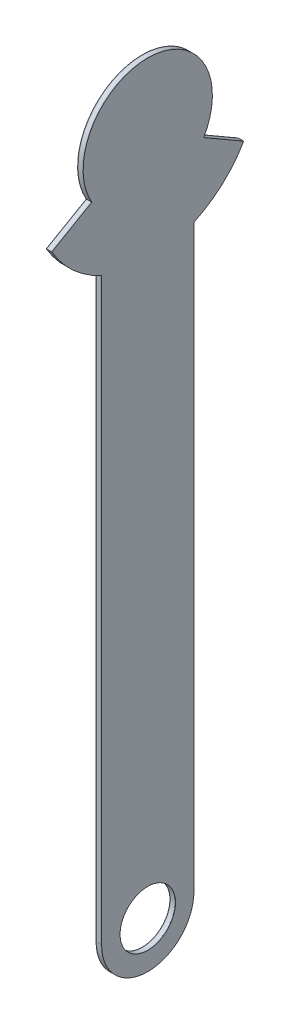
from build123d import *

# Parameters (mm, degrees)
SKETCH2_R           = 15
BOSS_EXTRUDE1_DEPTH = 0.25
SKETCH3_R           = 15
BOSS_EXTRUDE2_DEPTH = 2.5
SKETCH4_R           = 15
BOSS_EXTRUDE3_DEPTH = 0.25


with BuildPart() as part:
    # Sketch2 → Boss-Extrude1 (new body)
    with BuildSketch(Plane(origin=(0, 0, 0), x_dir=(0, 0, -1), z_dir=(1, 0, 0))):
        with BuildLine():
            ThreePointArc((-25, -171.8), (0, -196.8), (25, -171.8))
            Line((25, -171.8), (25, 142.256439427))
            ThreePointArc((25, 142.256439427), (40.390167668, 152.430704809), (51.961524227, 166.8))
            Line((51.961524227, 166.8), (30.310889132, 179.3))
            ThreePointArc((30.310889132, 179.3), (0, 231.8), (-30.310889132, 179.3))
            Line((-30.310889132, 179.3), (-51.961524227, 166.8))
            ThreePointArc((-51.961524227, 166.8), (-40.390167668, 152.430704809), (-25, 142.256439427))
            Line((-25, 142.256439427), (-25, -171.8))
        make_face()
        with Locations((0, -171.8)):
            Circle(SKETCH2_R, mode=Mode.SUBTRACT)
    extrude(amount=BOSS_EXTRUDE1_DEPTH)


with BuildPart() as body_2:
    # Sketch3 → Boss-Extrude2 (new body)
    with BuildSketch(Plane.ZY):
        with BuildLine():
            Line((51.961524227, 166.8), (30.310889132, 179.3))
            ThreePointArc((30.310889132, 179.3), (0, 231.8), (-30.310889132, 179.3))
            Line((-30.310889132, 179.3), (-51.961524227, 166.8))
            ThreePointArc((-51.961524227, 166.8), (-40.390167668, 152.430704809), (-25, 142.256439427))
            Line((-25, 142.256439427), (-25, -171.8))
            ThreePointArc((-25, -171.8), (0, -196.8), (25, -171.8))
            Line((25, -171.8), (25, 142.256439427))
            ThreePointArc((25, 142.256439427), (40.390167668, 152.430704809), (51.961524227, 166.8))
        make_face()
        with Locations((0, -171.8)):
            Circle(SKETCH3_R, mode=Mode.SUBTRACT)
    extrude(amount=BOSS_EXTRUDE2_DEPTH)


with BuildPart() as body_3:
    # Sketch4 → Boss-Extrude3 (new body)
    with BuildSketch(Plane.ZY.offset(2.5)):
        with BuildLine():
            ThreePointArc((25, 142.256439427), (40.390167668, 152.430704809), (51.961524227, 166.8))
            Line((51.961524227, 166.8), (30.310889132, 179.3))
            ThreePointArc((30.310889132, 179.3), (0, 231.8), (-30.310889132, 179.3))
            Line((-30.310889132, 179.3), (-51.961524227, 166.8))
            ThreePointArc((-51.961524227, 166.8), (-40.390167668, 152.430704809), (-25, 142.256439427))
            Line((-25, 142.256439427), (-25, -171.8))
            ThreePointArc((-25, -171.8), (0, -196.8), (25, -171.8))
            Line((25, -171.8), (25, 142.256439427))
        make_face()
        with Locations((0, -171.8)):
            Circle(SKETCH4_R, mode=Mode.SUBTRACT)
    extrude(amount=BOSS_EXTRUDE3_DEPTH)


solid = Compound([part.part, body_2.part, body_3.part])
